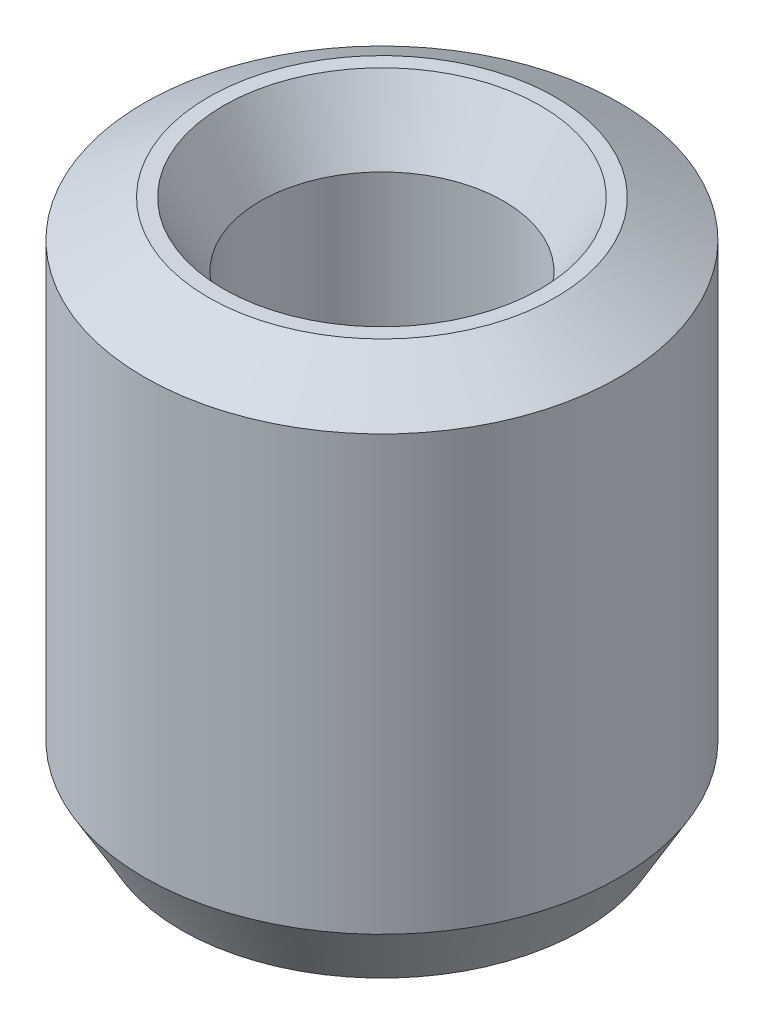
from build123d import *
from OCP.BRepFilletAPI import BRepFilletAPI_MakeChamfer

# Parameters (mm, degrees)
SKETCH1_R           = 20
BOSS_EXTRUDE1_DEPTH = 44.981452425
SKETCH2_R           = 10.241283353
CUT_EXTRUDE1_DEPTH  = 54.135026698
CHAMFER1_SIZE       = 3.112397966
CHAMFER1_SIZE2      = 5.39083141


with BuildPart() as part:
    # Sketch1 → Boss-Extrude1 (new body)
    with BuildSketch(Plane(origin=(0, 0, 0), x_dir=(1, 0, 0), z_dir=(0, 1, 0))):
        Circle(SKETCH1_R)
    extrude(amount=BOSS_EXTRUDE1_DEPTH)

    # Sketch2 → Cut-Extrude1 (cut, through all)
    with BuildSketch(Plane(origin=(0, 0, 0), x_dir=(1, 0, 0), z_dir=(0, 1, 0))):
        Circle(SKETCH2_R)
    extrude(amount=CUT_EXTRUDE1_DEPTH, mode=Mode.SUBTRACT)

    # Chamfer1: one chamfer whose edges measure the first distance from different faces: ONE call of the kernel's chamfer builder (chamfer() names one face for all edges)
    chamfer1_edges_1 = [part.edges().sort_by_distance(p)[0] for p in [
        (-10.241283353, 44.981452425, 0),
    ]]
    chamfer1_side_1 = [part.faces().sort_by_distance(p)[0] for p in [
        (-19.434314575, 44.981452425, 0),
    ]]
    chamfer1_edges_2 = [part.edges().sort_by_distance(p)[0] for p in [
        (-10.241283353, 0, 0),
    ]]
    chamfer1_side_2 = [part.faces().sort_by_distance(p)[0] for p in [
        (-10.241283353, 22.490726212, 0),
    ]]
    chamfer1_edges_3 = [part.edges().sort_by_distance(p)[0] for p in [
        (-20, 0, 0),
    ]]
    chamfer1_side_3 = [part.faces().sort_by_distance(p)[0] for p in [
        (-19.434314575, 0, 0),
    ]]
    chamfer1_edges_4 = [part.edges().sort_by_distance(p)[0] for p in [
        (-20, 44.981452425, 0),
    ]]
    chamfer1_side_4 = [part.faces().sort_by_distance(p)[0] for p in [
        (-20, 22.490726212, 0),
    ]]
    chamfer1 = BRepFilletAPI_MakeChamfer(part.part.solid().wrapped)
    for e in chamfer1_edges_1:
        chamfer1.Add(CHAMFER1_SIZE, CHAMFER1_SIZE2, e.wrapped, chamfer1_side_1[0].wrapped)  # the first distance lies on this face
    for e in chamfer1_edges_2:
        chamfer1.Add(CHAMFER1_SIZE, CHAMFER1_SIZE2, e.wrapped, chamfer1_side_2[0].wrapped)  # the first distance lies on this face
    for e in chamfer1_edges_3:
        chamfer1.Add(CHAMFER1_SIZE, CHAMFER1_SIZE2, e.wrapped, chamfer1_side_3[0].wrapped)  # the first distance lies on this face
    for e in chamfer1_edges_4:
        chamfer1.Add(CHAMFER1_SIZE, CHAMFER1_SIZE2, e.wrapped, chamfer1_side_4[0].wrapped)  # the first distance lies on this face
    add(Compound.cast(chamfer1.Shape()), mode=Mode.REPLACE)


solid = part.part
